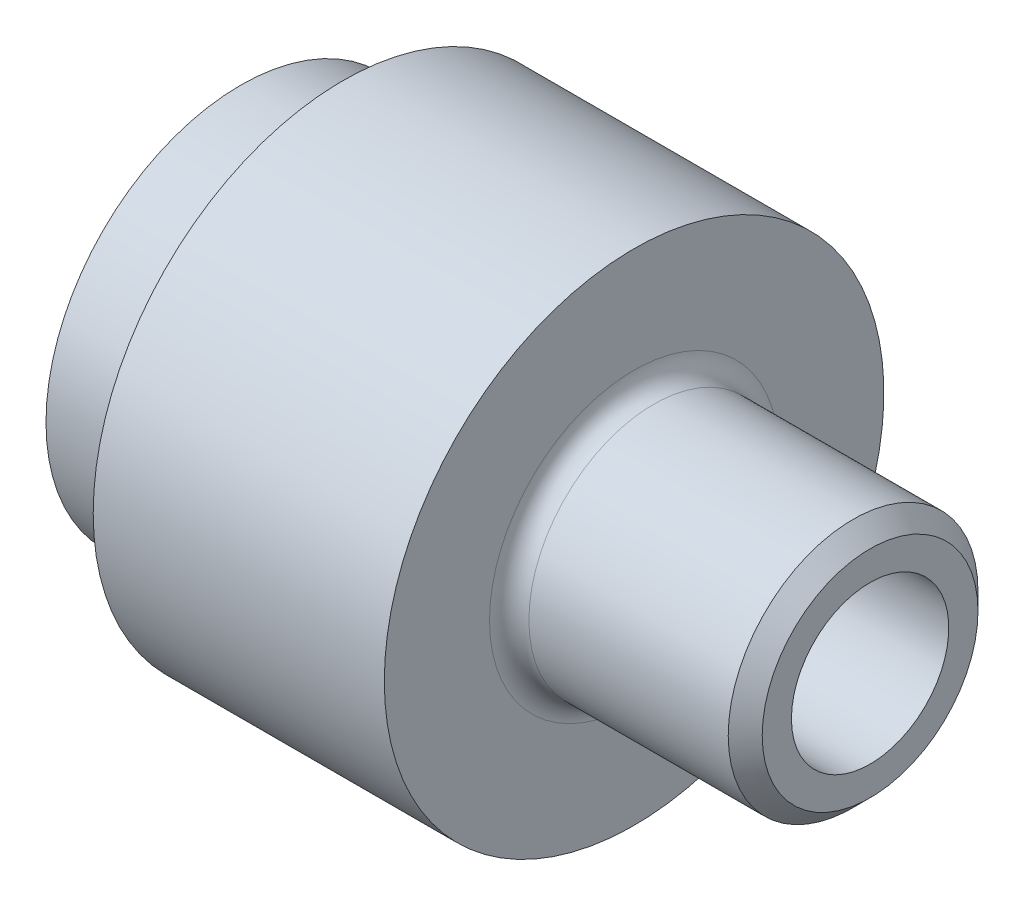
from build123d import *


# Read off the part's stored shape, not the designer's step: 1-1/4-7 Machine Threads Stud1
with BuildPart() as part:
    # Sketch1 → Revolve1 (revolve)
    with BuildSketch(Plane.XY, mode=Mode.PRIVATE) as revolve1_sk:
        with BuildLine():
            Line((-40.804054054, 10), (-27.804054054, 10))
            Line((-27.804054054, 10), (9.195945946, 10))
            Line((9.195945946, 10), (39.195945946, 10))
            Line((39.195945946, 10), (39.195945946, 15.875))
            Line((39.195945946, 15.875), (11.695945946, 15.875))
            ThreePointArc((11.695945946, 15.875), (9.928178993, 16.607233047), (9.195945946, 18.375))
            Line((9.195945946, 18.375), (9.195945946, 31.75))
            Line((9.195945946, 31.75), (-27.804054054, 31.75))
            Line((-27.804054054, 31.75), (-27.804054054, 24.75))
            Line((-27.804054054, 24.75), (-40.804054054, 24.75))
            Line((-40.804054054, 24.75), (-40.804054054, 10))
        make_face()
    revolve(revolve1_sk.sketch.rotate(Axis((-48.587837838, 0, 0), (1, 0, 0)), 90), axis=Axis((-48.587837838, 0, 0), (1, 0, 0)))

    # 1-1/4-7 Machine Threads Stud1 outline → 1-1/4-7 Machine Threads Stud1 (revolve, cut)
    with BuildSketch(Plane.YX):
        Polygon((15.875, 39.195945946), (13.71473, 39.195945946), (15.875, 37.035675946), align=None)
    revolve(axis=Axis((0, 0, 0), (1, 0, 0)), mode=Mode.SUBTRACT)


solid = part.part
